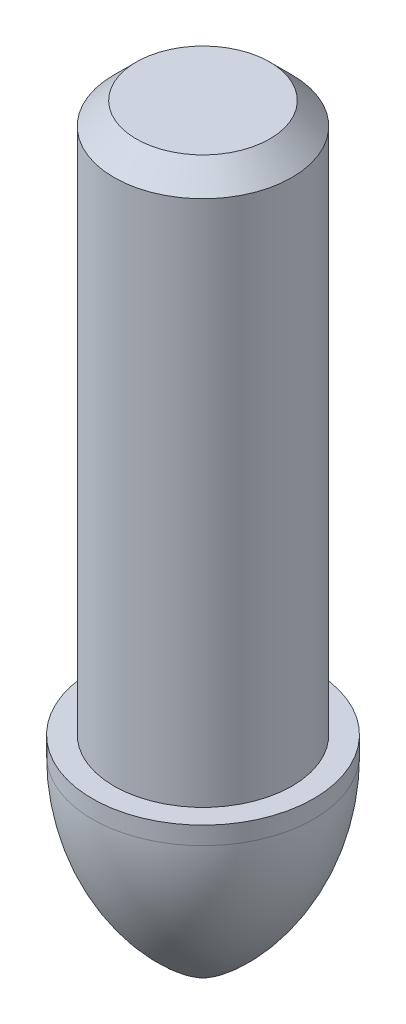
from build123d import *

# Parameters (mm, degrees)
CHAMFER1_SIZE = 1


with BuildPart() as part:
    # Sketch1 → Revolve1 (revolve)
    with BuildSketch(Plane.XY):
        with BuildLine():
            Line((0, 0), (4, 0))
            Line((4, 0), (4, -24.7))
            Line((4, -24.7), (4.976, -24.7))
            Line((4.976, -24.7), (4.976, -25.5))
            ThreePointArc((4.976, -25.5), (3.846610973, -30.10476271), (0.714778212, -33.6643951))
            ThreePointArc((0.714778212, -33.6643951), (0.374606751, -33.83147105), (0, -33.888923448))
            Line((0, -33.888923448), (0, 0))
        make_face()
    revolve(axis=Axis((0, 0, 0), (0, -1, 0)))

    # Chamfer1
    chamfer1_edges = [part.edges().sort_by_distance(p)[0] for p in [
        (-4, 0, 0),
    ]]
    chamfer(chamfer1_edges, length=CHAMFER1_SIZE)


solid = part.part
